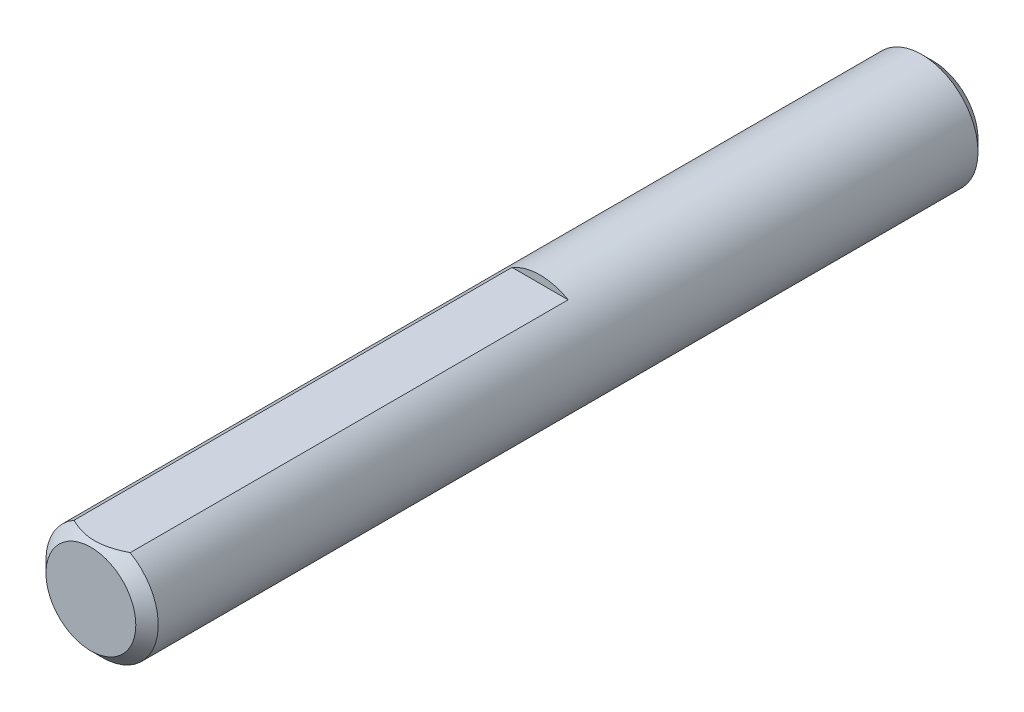
from build123d import *

# Parameters (mm, degrees)
SKETCH1_R      = 3.175
EXTRUDE1_DEPTH = 23.8125
CHAMFER1_SIZE  = 0.635
EXTRUDE7_DEPTH = 26.793821935


with BuildPart() as part:
    # Sketch1 → Extrude1 (new, symmetric)
    with BuildSketch(Plane.XY):
        Circle(SKETCH1_R)
    extrude(amount=EXTRUDE1_DEPTH, both=True)

    # Chamfer1
    chamfer1_edges = [part.edges().sort_by_distance(p)[0] for p in [
        (-3.175, 0, -23.8125),
        (-3.175, 0, 23.8125),
    ]]
    chamfer(chamfer1_edges, length=CHAMFER1_SIZE)

    # Sketch13 → Extrude7 (cut, through all)
    with BuildSketch(Plane.XY.offset(-1.5875)):
        with BuildLine():
            Line((-1.5875, 2.749630657), (1.5875, 2.749630657))
            ThreePointArc((1.5875, 2.749630657), (0, 3.175), (-1.5875, 2.749630657))
        make_face()
    extrude(amount=EXTRUDE7_DEPTH, mode=Mode.SUBTRACT)


solid = part.part
